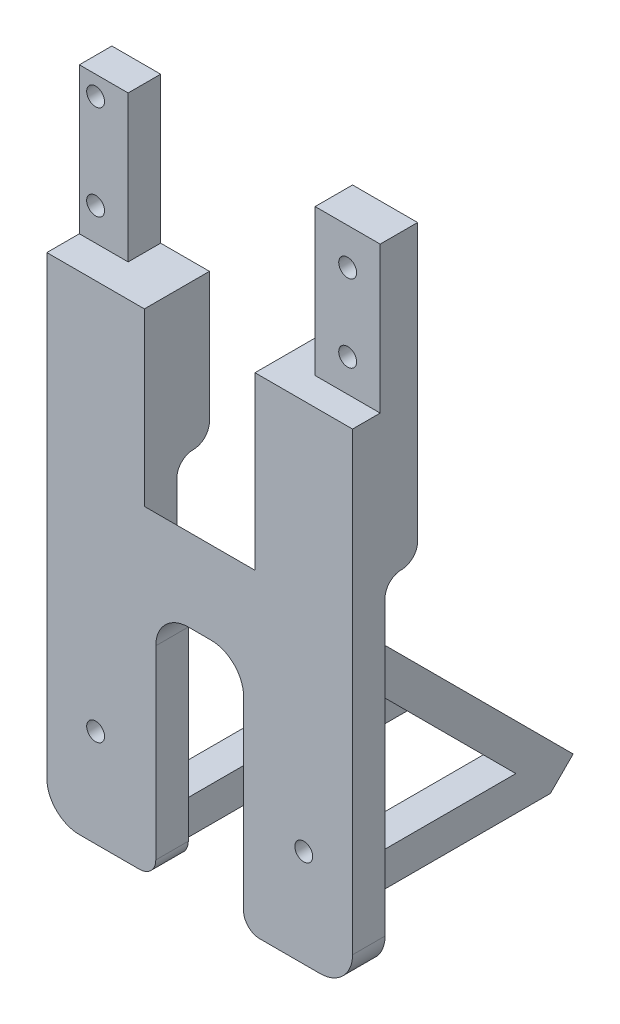
from build123d import *

# Parameters (mm, degrees)
SKETCH2_W               = 34
SKETCH2_H               = 20
SKETCH2_W_2             = 30
SKETCH2_H_2             = 150
BOSS_EXTRUDE1_DEPTH     = 10
SKETCH3_W               = 20
SKETCH3_H               = 45
SKETCH3_R               = 2.75
BOSS_EXTRUDE2_DEPTH     = 1.5
SKETCH4_W               = 15
SKETCH4_H               = 45
SKETCH4_R               = 2.75
BOSS_EXTRUDE3_DEPTH     = 10
SKETCH5_R               = 2.75
BOSS_EXTRUDE4_DEPTH     = 10
FILLET1_R               = 5
SKETCH6_W               = 34
SKETCH6_H               = 10
BOSS_EXTRUDE5_DEPTH     = 70
BOSS_EXTRUDE6_REACH     = 246.665
CUT_EXTRUDE1_DEPTH      = 34
FILLET2_R               = 5
CUT_EXTRUDE2_START      = -20
CUT_EXTRUDE2_DEPTH      = 20
CUT_EXTRUDE3_DEPTH      = 20
BOSS_EXTRUDE7_DEPTH     = 54
CUT_EXTRUDE4_DEPTH      = 240.922546822
CUT_EXTRUDE4_DEPTH_BACK = 240.922546822
CUT_EXTRUDE5_DEPTH      = 240.922546822
CUT_EXTRUDE5_DEPTH_BACK = 240.922546822
BOSS_EXTRUDE8_DEPTH     = 54
CUT_EXTRUDE6_DEPTH      = 248.030112784
CUT_EXTRUDE6_DEPTH_BACK = 248.030112784
SKETCH18_R              = 2.2
CUT_EXTRUDE7_DEPTH      = 9.92254106
SKETCH20_W              = 54
SKETCH20_H              = 9.922541059
BOSS_EXTRUDE9_DEPTH     = 25
SKETCH21_R              = 2.2
CUT_EXTRUDE8_DEPTH      = 25
BOSS_EXTRUDE10_START    = 13
SKETCH22_R              = 2.2
BOSS_EXTRUDE10_DEPTH    = 13
SKETCH23_W              = 13
SKETCH23_H              = 77.7
CUT_EXTRUDE10_DEPTH     = 13
SKETCH24_W              = 27
SKETCH24_H              = 27
CUT_EXTRUDE11_DEPTH     = 10
CUT_EXTRUDE12_DEPTH     = 10
BOSS_EXTRUDE11_DEPTH    = 10
BOSS_EXTRUDE12_DEPTH    = 10
FILLET3_R               = 10
FILLET4_R               = 5
FILLET5_R               = 10
CUT_EXTRUDE14_DEPTH     = 250.319480135


with BuildPart() as part:
    # Sketch2 → Boss-Extrude1 (new body)
    with BuildSketch(Plane.XY):
        Polygon((10, -225), (10, -205), (10, -75), (-20, -75), (-20, -225), align=None)
        with Locations((27, -215)):
            Rectangle(SKETCH2_W, SKETCH2_H)
        with Locations((59, -150)):
            Rectangle(SKETCH2_W_2, SKETCH2_H_2)
    extrude(amount=-BOSS_EXTRUDE1_DEPTH)

    # Sketch3 → Boss-Extrude2 (add)
    with BuildSketch(Plane(origin=(0, 0, -8.5), x_dir=(-1, 0, 0), z_dir=(0, 0, -1))):
        with Locations((-64, -52.5)):
            Rectangle(SKETCH3_W, SKETCH3_H)
        with Locations((-64, -65)):
            Circle(SKETCH3_R, mode=Mode.SUBTRACT)
        with Locations((-64, -41.25)):
            Circle(SKETCH3_R, mode=Mode.SUBTRACT)
    extrude(amount=BOSS_EXTRUDE2_DEPTH)

    # Sketch4 → Boss-Extrude3 (add)
    # profile 1 of 2: a face of its own
    with BuildSketch(Plane(origin=(0, 0, -10), x_dir=(-1, 0, 0), z_dir=(0, 0, -1))):
        Polygon((20, -75), (5, -75), (-10, -75), (-10, -120), (20, -120), align=None)
    # profile 2 of 2: a face of its own
    with BuildSketch(Plane(origin=(0, 0, -10), x_dir=(-1, 0, 0), z_dir=(0, 0, -1))):
        with Locations((12.5, -52.5)):
            Rectangle(SKETCH4_W, SKETCH4_H)
        with Locations((15, -65)):
            Circle(SKETCH4_R, mode=Mode.SUBTRACT)
        with Locations((15, -35.919713403)):
            Circle(SKETCH4_R, mode=Mode.SUBTRACT)
    extrude(amount=BOSS_EXTRUDE3_DEPTH)

    # Sketch5 → Boss-Extrude4 (add)
    with BuildSketch(Plane(origin=(0, 0, -10), x_dir=(-1, 0, 0), z_dir=(0, 0, -1))):
        Polygon((-74, -120), (-44, -120), (-44, -75), (-54, -75), (-54, -30), (-74, -30), align=None)
        with Locations(Location((-64, -65, 0), (0, 0, 270))):
            Circle(SKETCH5_R, mode=Mode.SUBTRACT)
        with Locations(Location((-64, -41.25, 0), (0, 0, 270))):
            Circle(SKETCH5_R, mode=Mode.SUBTRACT)
    extrude(amount=BOSS_EXTRUDE4_DEPTH)

    # Fillet1
    fillet1_edges = [part.edges().sort_by_distance(p)[0] for p in [
        (59, -120, -10),
        (-5, -120, -10),
    ]]
    fillet(fillet1_edges, radius=FILLET1_R)
    fillet1_2_edges = [part.edges().sort_by_distance(p)[0] for p in [
        (59, -120, -20),
        (-5, -120, -20),
    ]]
    fillet(fillet1_2_edges, radius=FILLET1_R - 0.0001)  # a hair under: the kernel refuses the full size

    # Sketch6 → Boss-Extrude5 (add)
    with BuildSketch(Plane(origin=(0, -205, 0), x_dir=(1, 0, 0), z_dir=(0, 1, 0))):
        with Locations((27, 5)):
            Rectangle(SKETCH6_W, SKETCH6_H)
    extrude(amount=BOSS_EXTRUDE5_DEPTH)

    # Boss-Extrude6: up to this face of the body (flat: up to its plane)
    boss_extrude6_end = Plane(part.part.faces().sort_by_distance((74, -119.982060157, -8.746792457))[0])
    # Sketch7 → Boss-Extrude6 (add, up to the picked face)
    with BuildSketch(Plane.ZY.offset(20), mode=Mode.PRIVATE) as boss_extrude6_sk1:
        Polygon((-10, -137.603336753), (-34.698331624, -162.301668376), (-45.304933341, -172.908270094), (-10, -172.908270094), align=None)
    boss_extrude6_tool1 = split(extrude(boss_extrude6_sk1.sketch, amount=-BOSS_EXTRUDE6_REACH, mode=Mode.PRIVATE), bisect_by=boss_extrude6_end, keep=Keep.BOTH, mode=Mode.PRIVATE)
    # Sketch7 → Boss-Extrude6 (add, up to the picked face)
    with BuildSketch(Plane.ZY.offset(20), mode=Mode.PRIVATE) as boss_extrude6_sk2:
        Polygon((0, -127.603336753), (-10, -137.603336753), (-10, -172.908270094), (0, -172.908270094), align=None)
    boss_extrude6_tool2 = split(extrude(boss_extrude6_sk2.sketch, amount=-BOSS_EXTRUDE6_REACH, mode=Mode.PRIVATE), bisect_by=boss_extrude6_end, keep=Keep.BOTH, mode=Mode.PRIVATE)
    add(boss_extrude6_tool1.solids().sort_by(Axis((-20, -161.139959, -21.768311), (1, 0, 0)))[0])
    add(boss_extrude6_tool2.solids().sort_by(Axis((-20, -152.652425, -4.793243), (1, 0, 0)))[0])

    # Sketch8 → Cut-Extrude1 (cut)
    with BuildSketch(Plane.ZY.offset(-44)):
        Polygon((-7.396663247, -135), (-10.086941063, -137.690277816), (-10, -135), align=None)
    extrude(amount=CUT_EXTRUDE1_DEPTH, mode=Mode.SUBTRACT)

    # Fillet2
    fillet2_edges = [part.edges().sort_by_distance(p)[0] for p in [
        (27, -172.908270094, -45.304933341),
    ]]
    fillet(fillet2_edges, radius=FILLET2_R)

    # Sketch9 → Cut-Extrude2 (cut)
    with BuildSketch(Plane.ZY.offset(20).offset(CUT_EXTRUDE2_START)):
        with BuildLine():
            Line((-10, -172.908270094), (-10, -137.603336753))
            Line((-10, -137.603336753), (-36.769399436, -164.372736188))
            ThreePointArc((-36.769399436, -164.372736188), (-37.853263192, -169.821687256), (-33.23386553, -172.908270094))
            Line((-33.23386553, -172.908270094), (-10, -172.908270094))
        make_face()
    extrude(amount=CUT_EXTRUDE2_DEPTH, mode=Mode.SUBTRACT)

    # Sketch10 → Cut-Extrude3 (cut)
    with BuildSketch(Plane(origin=(74, 0, 0), x_dir=(0, 0, -1), z_dir=(1, 0, 0))):
        with BuildLine():
            Line((10, -137.603336753), (10, -172.908270094))
            Line((10, -172.908270094), (33.23386553, -172.908270094))
            ThreePointArc((33.23386553, -172.908270094), (37.853263192, -169.821687256), (36.769399436, -164.372736188))
            Line((36.769399436, -164.372736188), (10, -137.603336753))
        make_face()
    extrude(amount=-CUT_EXTRUDE3_DEPTH, mode=Mode.SUBTRACT)

    # Sketch12 → Boss-Extrude7 (add)
    with BuildSketch(Plane.ZY):
        Polygon((-10, -137.603336753), (22.716423027, -106.706157847), (36.44850254, -121.246790303), (-10, -165.112456538), align=None)
    extrude(amount=-BOSS_EXTRUDE7_DEPTH)

    # Sketch13 → Cut-Extrude4 (cut, two sides: drawn at the far end of the back side and taken through both)
    with BuildSketch(Plane(origin=(54, 0, 0), x_dir=(0, 0, -1), z_dir=(1, 0, 0)).offset(-CUT_EXTRUDE4_DEPTH_BACK)):
        Polygon((17.239749062, -172.908270094), (10, -165.668521032), (10, -172.908270094), align=None)
    extrude(amount=CUT_EXTRUDE4_DEPTH + CUT_EXTRUDE4_DEPTH_BACK, mode=Mode.SUBTRACT)

    # Sketch14 → Cut-Extrude5 (cut, two sides: drawn at the far end of the back side and taken through both)
    with BuildSketch(Plane(origin=(54, 0, 0), x_dir=(0, 0, -1), z_dir=(1, 0, 0)).offset(-CUT_EXTRUDE5_DEPTH_BACK)):
        Polygon((-36.44850254, -121.246790303), (0, -155.668521032), (0, -128.159401246), (-22.716423027, -106.706157847), align=None)
    extrude(amount=CUT_EXTRUDE5_DEPTH + CUT_EXTRUDE5_DEPTH_BACK, mode=Mode.SUBTRACT)

    # Sketch15 → Boss-Extrude8 (add)
    with BuildSketch(Plane(origin=(54, 0, 0), x_dir=(0, 0, -1), z_dir=(1, 0, 0))):
        with BuildLine():
            Line((17.239749062, -172.908270094), (56.130622027, -211.799143059))
            Line((56.130622027, -211.799143059), (70.163214167, -197.76655092))
            Line((70.163214167, -197.76655092), (36.769399436, -164.372736188))
            ThreePointArc((36.769399436, -164.372736188), (37.853263192, -169.821687256), (33.23386553, -172.908270094))
            Line((33.23386553, -172.908270094), (17.239749062, -172.908270094))
        make_face()
    extrude(amount=-BOSS_EXTRUDE8_DEPTH)

    # Sketch16 → Cut-Extrude6 (cut, two sides: drawn at the far end of the back side and taken through both)
    with BuildSketch(Plane(origin=(54, 0, 0), x_dir=(0, 0, -1), z_dir=(1, 0, 0)).offset(-CUT_EXTRUDE6_DEPTH_BACK)):
        Polygon((63.146918097, -204.78284699), (10, -151.635928892), (10, -165.668521032), (56.130622027, -211.799143059), align=None)
    extrude(amount=CUT_EXTRUDE6_DEPTH + CUT_EXTRUDE6_DEPTH_BACK, mode=Mode.SUBTRACT)

    # Sketch18 → Cut-Extrude7 (cut)
    with BuildSketch(Plane(origin=(0, -63.801668376, 63.801668376), x_dir=(1, 0, 0), z_dir=(0, 0.707106781186546, -0.7071067811865491))):
        with Locations(Location((27, 144.300035894, 0), (0, 0, 270))):
            Circle(SKETCH18_R)
        with Locations(Location((27, 134.300035894, 0), (0, 0, 270))):
            Circle(SKETCH18_R)
    extrude(amount=-CUT_EXTRUDE7_DEPTH, mode=Mode.SUBTRACT)

    # Sketch20 → Boss-Extrude9 (add)
    with BuildSketch(Plane(origin=(0, -133.964882543, -133.964882543), x_dir=(1, 0, 0), z_dir=(0, -0.707106781186548, -0.7071067811865471))):
        with Locations((27, 95.19045525)):
            Rectangle(SKETCH20_W, SKETCH20_H)
    extrude(amount=BOSS_EXTRUDE9_DEPTH)

    # Sketch21 → Cut-Extrude8 (cut)
    with BuildSketch(Plane(origin=(0, -63.801668376, 63.801668376), x_dir=(1, 0, 0), z_dir=(0, 0.707106781186546, -0.7071067811865491))):
        with Locations(Location((27, 199.600035894, 0), (0, 0, 270))):
            Circle(SKETCH21_R)
        with Locations(Location((27, 188.700035894, 0), (0, 0, 270))):
            Circle(SKETCH21_R)
    extrude(amount=-CUT_EXTRUDE8_DEPTH, mode=Mode.SUBTRACT)

    # Sketch22 → Boss-Extrude10 (add)
    with BuildSketch(Plane(origin=(0, -63.801668376, 63.801668376), x_dir=(1, 0, 0), z_dir=(0, 0.707106781186546, -0.7071067811865491)).offset(BOSS_EXTRUDE10_START)):
        Polygon((33.5, 205.800035894), (27, 205.800035894), (20.5, 205.800035894), (20.5, 128.100035894), (27, 128.100035894), (33.5, 128.100035894), align=None)
        with BuildLine():
            ThreePointArc((29.2, 134.300035894), (28.555634919, 132.744400975), (27, 132.100035894))
            ThreePointArc((27, 132.100035894), (25.444365081, 135.855670812), (29.2, 134.300035894))
        make_face(mode=Mode.SUBTRACT)
        with Locations((27, 144.300035894)):
            Circle(SKETCH22_R, mode=Mode.SUBTRACT)
        with Locations((27, 188.700035894)):
            Circle(SKETCH22_R, mode=Mode.SUBTRACT)
        with BuildLine():
            ThreePointArc((29.2, 199.600035894), (25.444365081, 198.044400975), (27, 201.800035894))
            ThreePointArc((27, 201.800035894), (28.555634919, 201.155670812), (29.2, 199.600035894))
        make_face(mode=Mode.SUBTRACT)
    extrude(amount=-BOSS_EXTRUDE10_DEPTH)

    # Sketch23 → Cut-Extrude10 (cut)
    with BuildSketch(Plane(origin=(0, -54.609280221, 54.609280221), x_dir=(1, 0, 0), z_dir=(0, 0.707106781186546, -0.707106781186549))):
        with Locations((27, 166.950035894)):
            Rectangle(SKETCH23_W, SKETCH23_H)
    extrude(amount=-CUT_EXTRUDE10_DEPTH, mode=Mode.SUBTRACT)

    # Sketch24 → Cut-Extrude11 (cut)
    with BuildSketch(Plane(origin=(0, -63.801668376, 63.801668376), x_dir=(1, 0, 0), z_dir=(0, 0.707106781186546, -0.7071067811865491))):
        with Locations((27, 139.600035894)):
            Rectangle(SKETCH24_W, SKETCH24_H)
    extrude(amount=-CUT_EXTRUDE11_DEPTH, mode=Mode.SUBTRACT)

    # Sketch25 → Cut-Extrude12 (cut)
    with BuildSketch(Plane(origin=(0, 0, -10), x_dir=(-1, 0, 0), z_dir=(0, 0, -1))):
        Polygon((-40.5, -152.967858865), (-40.5, -233.312040373), (-13.5, -234.023370682), (-13.5, -152.967858865), align=None)
    extrude(amount=-CUT_EXTRUDE12_DEPTH, mode=Mode.SUBTRACT)

    # Sketch26 → Boss-Extrude11 (add)
    with BuildSketch(Plane(origin=(54, 0, 0), x_dir=(0, 0, -1), z_dir=(1, 0, 0))):
        Polygon((80.824587627, -222.460516519), (6.638247164, -222.460516519), (3.697137503, -222.460516519), (3.697137503, -211.853914801), (70.217985909, -211.853914801), align=None)
    extrude(amount=-BOSS_EXTRUDE11_DEPTH)

    # Sketch27 → Boss-Extrude12 (add)
    with BuildSketch(Plane.ZY):
        Polygon((-10, -222.460516519), (-10, -211.853914801), (-70.217985909, -211.853914801), (-80.824587627, -222.460516519), align=None)
    extrude(amount=-BOSS_EXTRUDE12_DEPTH)

    # Fillet3
    fillet3_edges = [part.edges().sort_by_distance(p)[0] for p in [
        (-20, -225, -5),
        (74, -225, -5),
    ]]
    fillet(fillet3_edges, radius=FILLET3_R)

    # Fillet4
    fillet4_edges = [part.edges().sort_by_distance(p)[0] for p in [
        (13.5, -225, -5),
        (40.5, -225, -5),
    ]]
    fillet(fillet4_edges, radius=FILLET4_R)

    # Fillet5
    fillet5_edges = [part.edges().sort_by_distance(p)[0] for p in [
        (13.5, -152.967858865, -5),
        (40.5, -152.967858865, -5),
    ]]
    fillet(fillet5_edges, radius=FILLET5_R)

    # Sketch28 → Cut-Extrude14 (cut, through all)
    with BuildSketch(Plane(origin=(0, 0, -10), x_dir=(-1, 0, 0), z_dir=(0, 0, -1))):
        with BuildLine():
            Line((-61.75, -195), (-59, -195))
            Line((-59, -195), (-56.25, -195))
            ThreePointArc((-56.25, -195), (-59, -192.25), (-61.75, -195))
        make_face()
        with BuildLine():
            Line((-56.25, -195), (-59, -195))
            Line((-59, -195), (-61.75, -195))
            ThreePointArc((-61.75, -195), (-59, -197.75), (-56.25, -195))
        make_face()
        with BuildLine():
            ThreePointArc((7.75, -195), (5, -192.25), (2.25, -195))
            Line((2.25, -195), (5, -195))
            Line((5, -195), (7.75, -195))
        make_face()
        with BuildLine():
            Line((5, -195), (2.25, -195))
            ThreePointArc((2.25, -195), (5, -197.75), (7.75, -195))
            Line((7.75, -195), (5, -195))
        make_face()
    extrude(amount=-CUT_EXTRUDE14_DEPTH, mode=Mode.SUBTRACT)


solid = part.part
